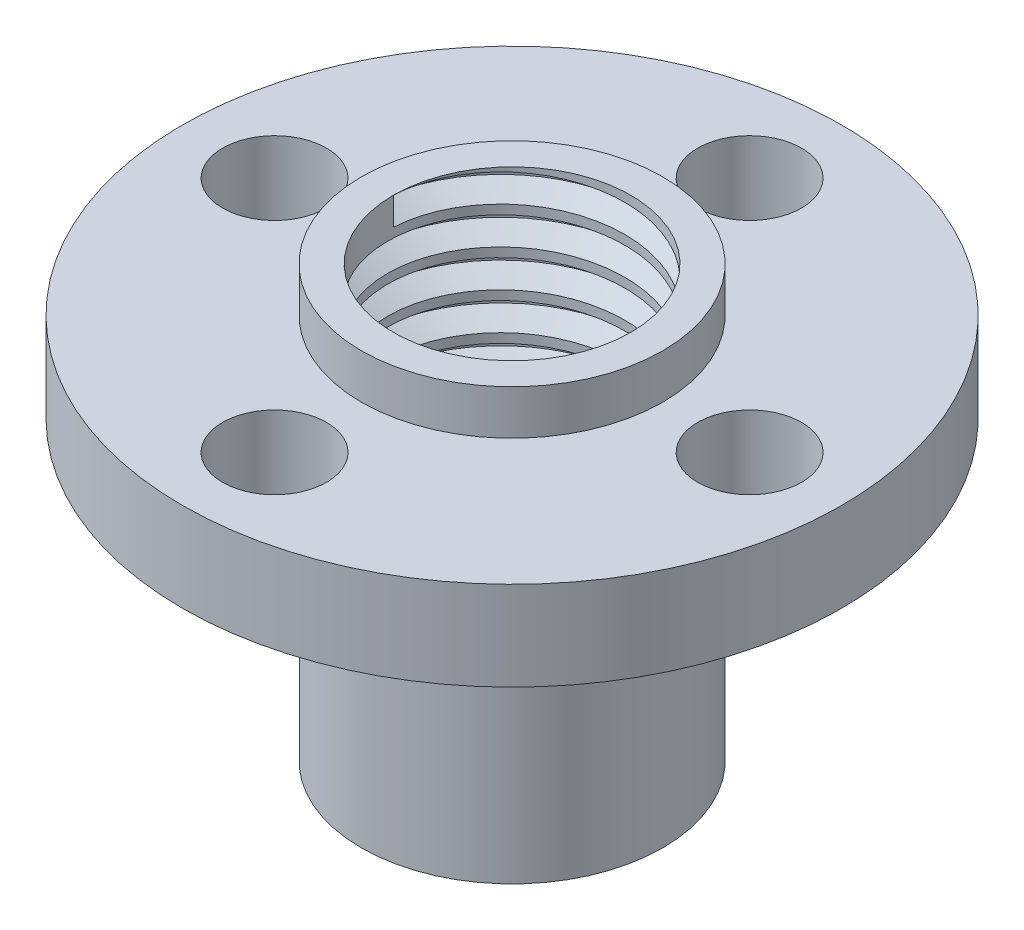
from build123d import *

# Parameters (mm, degrees)
BOSS_EXTRUDE1_DEPTH      = 4.5
BOSS_EXTRUDE1_DEPTH_BACK = 10
SKETCH1_R                = 5.075
SKETCH1_R_2              = 4
SKETCH2_R                = 11.1
SKETCH2_R_2              = 5.075
SKETCH2_R_3              = 1.75
BOSS_EXTRUDE2_DEPTH      = 3
THREAD1_PITCH            = 1.25


with BuildPart() as part:
    # Sketch1 → Boss-Extrude1 (new, two sides: drawn at the far end of the back side and taken through both)
    with BuildSketch(Plane(origin=(0, 0, 0), x_dir=(1, 0, 0), z_dir=(0, 1, 0)).offset(-BOSS_EXTRUDE1_DEPTH_BACK)):
        with Locations(Location((0, 0, 0), (0, 0, 270))):
            Circle(SKETCH1_R)
        with Locations(Location((0, 0, 0), (0, 0, 270))):
            Circle(SKETCH1_R_2, mode=Mode.SUBTRACT)
    extrude(amount=BOSS_EXTRUDE1_DEPTH + BOSS_EXTRUDE1_DEPTH_BACK)

    # Sketch2 → Boss-Extrude2 (add)
    with BuildSketch(Plane(origin=(0, 0, 0), x_dir=(1, 0, 0), z_dir=(0, 1, 0))):
        with Locations(Location((0, 0, 0), (0, 0, 270))):
            Circle(SKETCH2_R)
        with Locations(Location((0, 0, 0), (0, 0, 270))):
            Circle(SKETCH2_R_2, mode=Mode.SUBTRACT)
        with Locations(Location((-8, 0, 0), (0, 0, 270))):
            Circle(SKETCH2_R_3, mode=Mode.SUBTRACT)
        with Locations(Location((0, 8, 0), (0, 0, 270))):
            Circle(SKETCH2_R_3, mode=Mode.SUBTRACT)
        with Locations(Location((8, 0, 0), (0, 0, 270))):
            Circle(SKETCH2_R_3, mode=Mode.SUBTRACT)
        with Locations(Location((0, -8, 0), (0, 0, 270))):
            Circle(SKETCH2_R_3, mode=Mode.SUBTRACT)
    extrude(amount=BOSS_EXTRUDE2_DEPTH)

    # Thread1: the profile of Thread Profile1 profile screwed along a right-hand helix of 11.6 turns, 8 arcs to a turn; built about Z, then put on its axis
    thread1_z = Axis((0, 0, 0), (0, 0, 1))
    thread1_corners = [(3.9997, 0, -0.000173205), (4.676582344, 0, 0.390624998), (4.676582344, 0, 0.546874998), (3.9997, 0, 0.937673202)]
    with BuildLine(mode=Mode.PRIVATE) as thread1_profile:
        Line(thread1_corners[0], thread1_corners[1])
        Line(thread1_corners[1], thread1_corners[2])
        Line(thread1_corners[2], thread1_corners[3])
        Line(thread1_corners[3], thread1_corners[0])
    thread1_cap = Face(thread1_profile.wire())
    thread1_turn_angles = [0, 22.5, 45, 67.5, 90, 112.5, 135, 157.5, 180, 202.5, 225, 247.5, 270, 292.5, 315, 337.5, 360]
    thread1_turn_weights = [1, 0.9238795325112867, 1, 0.9238795325112867, 1, 0.9238795325112867, 1, 0.9238795325112867, 1, 0.9238795325112867, 1, 0.9238795325112867, 1, 0.9238795325112867, 1, 0.9238795325112867, 1]
    thread1_turn_rails = [Edge.make_bspline([Vector(p[0], p[1], 0).rotate(thread1_z, thread1_turn_angles[k]) / thread1_turn_weights[k] + Vector(0, 0, p[2] + THREAD1_PITCH * thread1_turn_angles[k] / 360) for k in range(17)], [0, 0, 0, 1, 1, 2, 2, 3, 3, 4, 4, 5, 5, 6, 6, 7, 7, 8, 8, 8], 2, thread1_turn_weights) for p in thread1_corners]
    thread1_turn_sides = [Face.make_surface_from_curves(thread1_turn_rails[p[0]], thread1_turn_rails[p[1]]) for p in [(0, 1), (1, 2), (2, 3), (3, 0)]]
    thread1_last_angles = [3960, 3982.5, 4005, 4027.5, 4050, 4072.5, 4095, 4117.5, 4140, 4158, 4176]
    thread1_last_weights = [1, 0.9238795325112867, 1, 0.9238795325112867, 1, 0.9238795325112867, 1, 0.9238795325112867, 1, 0.951056516295156, 1]
    thread1_last_rails = [Edge.make_bspline([Vector(p[0], p[1], 0).rotate(thread1_z, thread1_last_angles[k]) / thread1_last_weights[k] + Vector(0, 0, p[2] + THREAD1_PITCH * thread1_last_angles[k] / 360) for k in range(11)], [0, 0, 0, 1, 1, 2, 2, 3, 3, 4, 4, 5, 5, 5], 2, thread1_last_weights) for p in thread1_corners]
    thread1_last_sides = [Face.make_surface_from_curves(thread1_last_rails[p[0]], thread1_last_rails[p[1]]) for p in [(0, 1), (1, 2), (2, 3), (3, 0)]]
    thread1 = Plane(origin=(0, 4.5, 0), x_dir=(-1, 0, 0), z_dir=(0, -1, 0)) * Solid(Shell([*[p.moved(Location((0, 0, THREAD1_PITCH * i))) for i in range(11) for p in thread1_turn_sides], *thread1_last_sides, thread1_cap, thread1_cap.rotate(thread1_z, 4176).moved(Location((0, 0, THREAD1_PITCH * 4176 / 360)))]))
    add(thread1, mode=Mode.SUBTRACT)


solid = part.part
